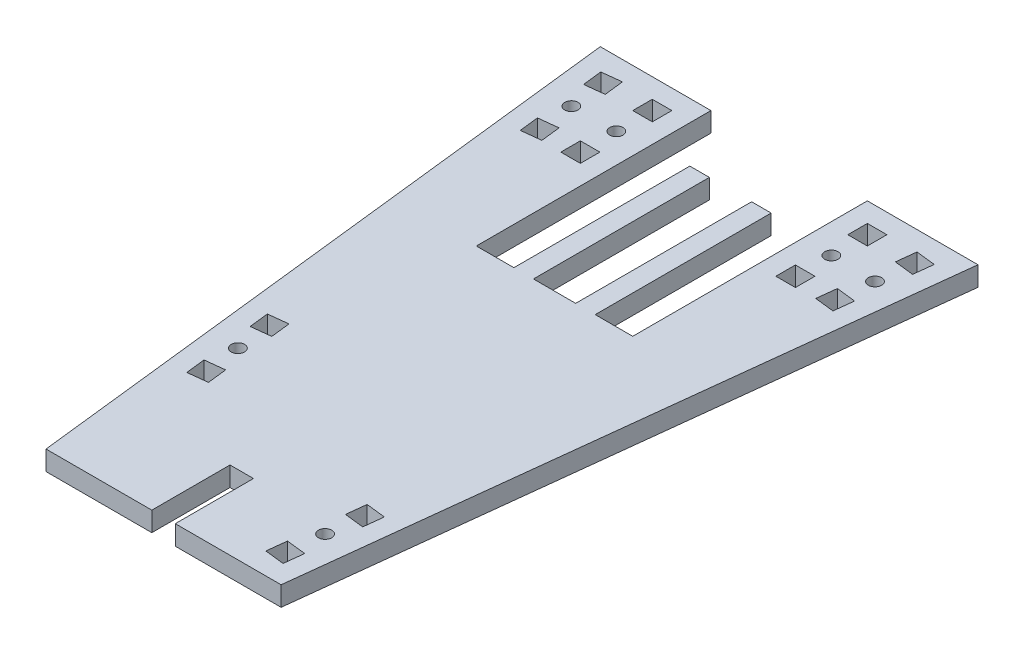
from build123d import *

# Parameters (mm, degrees)
SKETCH1_R           = 2.159
SKETCH1_W           = 6.35
SKETCH1_H           = 6.35
BOSS_EXTRUDE1_DEPTH = 6.35


with BuildPart() as part:
    # Sketch1 → Boss-Extrude1 (new body)
    with BuildSketch(Plane(origin=(0, 0, 0), x_dir=(1, 0, 0), z_dir=(0, 1, 0))):
        Polygon((-25.4, 76.2), (-48.561094225, 76.2), (-61.343326199, 76.2), (-38.182231974, -127), (-25.4, -127), (-3.81, -127), (-3.81, -101.6), (3.81, -101.6), (3.81, -127), (25.4, -127), (38.182231974, -127), (61.343326199, 76.2), (48.561094225, 76.2), (25.4, 76.2), (25.4, 0), (13.208, 0), (13.208, 57.15), (6.858, 57.15), (6.858, 0), (-6.858, 0), (-6.858, 57.15), (-13.208, 57.15), (-13.208, 0), (-25.4, 0), align=None)
        Polygon((-36.852949026, -82.590851475), (-37.572076897, -76.281702951), (-31.262928372, -75.56257508), (-30.543800501, -81.871723604), align=None, mode=Mode.SUBTRACT)
        with Locations((-35.381133982, -67.467879992)):
            Circle(SKETCH1_R, mode=Mode.SUBTRACT)
        Polygon((-33.909318939, -52.344908509), (-33.190191068, -58.654057034), (-39.499339592, -59.373184905), (-40.218467463, -53.064036381), align=None, mode=Mode.SUBTRACT)
        Polygon((26.920223205, -113.66257508), (33.22937173, -114.381702951), (32.510243858, -120.690851475), (26.201095334, -119.971723604), align=None, mode=Mode.SUBTRACT)
        with Locations((31.038428815, -105.567879992)):
            Circle(SKETCH1_R, mode=Mode.SUBTRACT)
        Polygon((35.156634425, -97.473184905), (28.8474859, -96.754057034), (29.566613772, -90.444908509), (35.875762296, -91.164036381), align=None, mode=Mode.SUBTRACT)
        Polygon((-50.78559644, 39.644908509), (-51.504724312, 45.954057034), (-45.195575787, 46.673184905), (-44.476447916, 40.364036381), align=None, mode=Mode.SUBTRACT)
        with Locations((-34.925, 43.307)):
            Rectangle(SKETCH1_W, SKETCH1_H, mode=Mode.SUBTRACT)
        with Locations((-49.313781397, 54.767879992)):
            Circle(SKETCH1_R, mode=Mode.SUBTRACT)
        Polygon((-47.841966354, 69.890851475), (-47.122838482, 63.581702951), (-53.431987007, 62.86257508), (-54.151114878, 69.171723604), align=None, mode=Mode.SUBTRACT)
        with Locations((-34.925, 54.991)):
            Circle(SKETCH1_R, mode=Mode.SUBTRACT)
        with Locations((-34.925, 66.675)):
            Rectangle(SKETCH1_W, SKETCH1_H, mode=Mode.SUBTRACT)
        with Locations((34.925, 43.307)):
            Rectangle(SKETCH1_W, SKETCH1_H, mode=Mode.SUBTRACT)
        Polygon((45.195575787, 46.673184905), (51.504724312, 45.954057034), (50.78559644, 39.644908509), (44.476447916, 40.364036381), align=None, mode=Mode.SUBTRACT)
        with Locations((34.925, 54.991)):
            Circle(SKETCH1_R, mode=Mode.SUBTRACT)
        with Locations((34.925, 66.675)):
            Rectangle(SKETCH1_W, SKETCH1_H, mode=Mode.SUBTRACT)
        with Locations((49.313781397, 54.767879992)):
            Circle(SKETCH1_R, mode=Mode.SUBTRACT)
        Polygon((53.431987007, 62.86257508), (47.122838482, 63.581702951), (47.841966354, 69.890851475), (54.151114878, 69.171723604), align=None, mode=Mode.SUBTRACT)
    extrude(amount=BOSS_EXTRUDE1_DEPTH)


solid = part.part
